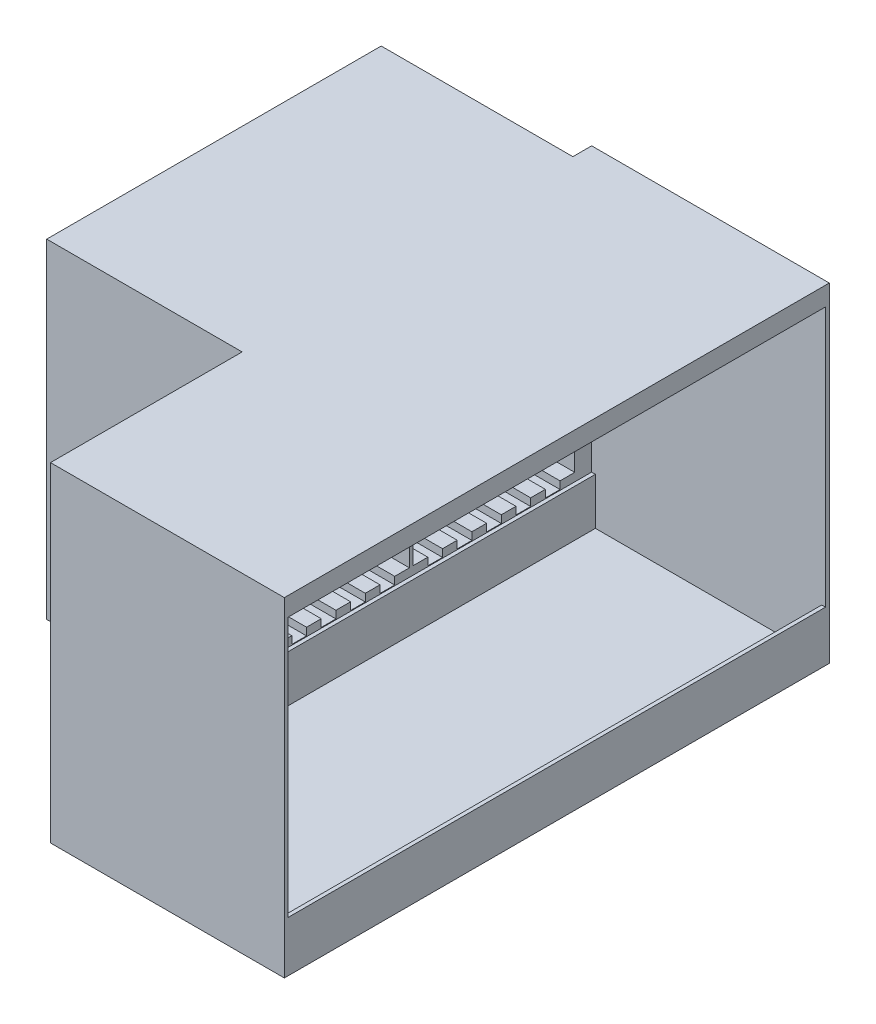
from build123d import *

# Parameters (mm, degrees)
SKETCH_3385_W                        = 940
SKETCH_3385_H                        = 876.56
EXTRUDE_3563_DEPTH                   = 1142.3
SKETCH_3604_W                        = 930
SKETCH_3604_H                        = 691.96
CUT_EXTRUDE_3663_DEPTH               = 622.3
SKETCH_3713_W                        = 430
SKETCH_3713_H                        = 320
CUT_EXTRUDE_3805_DEPTH               = 510
SKETCH_3856_W                        = 435
SKETCH_3856_H                        = 320
CUT_EXTRUDE_3949_DEPTH               = 10
SKETCH_3998_W                        = 602.3
SKETCH_3998_H                        = 930
CUT_EXTRUDE_4526_DEPTH               = 124.6
SKETCH_4575_W                        = 602.3
SKETCH_4575_H                        = 930
CUT_EXTRUDE_4706_DEPTH               = 40
SKETCH_4761_W                        = 39.090909091
SKETCH_4761_H                        = 20
CUT_EXTRUDE_4915_DEPTH               = 510
PATTERN_LINEAR_4969_COUNT            = 5
PATTERN_LINEAR_4969_PITCH            = 78.181818182
PATTERN_LINEAR_5037_COUNT            = 2
PATTERN_LINEAR_5037_PITCH            = 440
PATTERN_LINEAR_5037_COUNT_DIR2       = 2
PATTERN_LINEAR_5037_PITCH_DIR2       = 350
PATTERN_LINEAR_5037_COPY_1_SKETCH_W  = 39.090909091
PATTERN_LINEAR_5037_COPY_1_SKETCH_H  = 20
PATTERN_LINEAR_5037_COPY_1_DEPTH     = 510
PATTERN_LINEAR_5037_COPY_2_SKETCH_W  = 39.090909091
PATTERN_LINEAR_5037_COPY_2_SKETCH_H  = 20
PATTERN_LINEAR_5037_COPY_2_DEPTH     = 510
PATTERN_LINEAR_5037_COPY_3_SKETCH_W  = 39.090909091
PATTERN_LINEAR_5037_COPY_3_SKETCH_H  = 20
PATTERN_LINEAR_5037_COPY_3_DEPTH     = 510
PATTERN_LINEAR_5037_COPY_4_SKETCH_W  = 39.090909091
PATTERN_LINEAR_5037_COPY_4_SKETCH_H  = 20
PATTERN_LINEAR_5037_COPY_4_DEPTH     = 510
PATTERN_LINEAR_5037_COPY_5_SKETCH_W  = 39.090909091
PATTERN_LINEAR_5037_COPY_5_SKETCH_H  = 20
PATTERN_LINEAR_5037_COPY_5_DEPTH     = 510
PATTERN_LINEAR_5037_COPY_6_SKETCH_W  = 39.090909091
PATTERN_LINEAR_5037_COPY_6_SKETCH_H  = 20
PATTERN_LINEAR_5037_COPY_6_DEPTH     = 510
PATTERN_LINEAR_5037_COPY_7_SKETCH_W  = 39.090909091
PATTERN_LINEAR_5037_COPY_7_SKETCH_H  = 20
PATTERN_LINEAR_5037_COPY_7_DEPTH     = 510
PATTERN_LINEAR_5037_COPY_8_SKETCH_W  = 39.090909091
PATTERN_LINEAR_5037_COPY_8_SKETCH_H  = 20
PATTERN_LINEAR_5037_COPY_8_DEPTH     = 510
PATTERN_LINEAR_5037_COPY_9_SKETCH_W  = 39.090909091
PATTERN_LINEAR_5037_COPY_9_SKETCH_H  = 20
PATTERN_LINEAR_5037_COPY_9_DEPTH     = 510
PATTERN_LINEAR_5037_COPY_10_SKETCH_W = 39.090909091
PATTERN_LINEAR_5037_COPY_10_SKETCH_H = 20
PATTERN_LINEAR_5037_COPY_10_DEPTH    = 510
PATTERN_LINEAR_5037_COPY_11_SKETCH_W = 39.090909091
PATTERN_LINEAR_5037_COPY_11_SKETCH_H = 20
PATTERN_LINEAR_5037_COPY_11_DEPTH    = 510
PATTERN_LINEAR_5037_COPY_12_SKETCH_W = 39.090909091
PATTERN_LINEAR_5037_COPY_12_SKETCH_H = 20
PATTERN_LINEAR_5037_COPY_12_DEPTH    = 510
PATTERN_LINEAR_5037_COPY_13_SKETCH_W = 39.090909091
PATTERN_LINEAR_5037_COPY_13_SKETCH_H = 20
PATTERN_LINEAR_5037_COPY_13_DEPTH    = 510
PATTERN_LINEAR_5037_COPY_14_SKETCH_W = 39.090909091
PATTERN_LINEAR_5037_COPY_14_SKETCH_H = 20
PATTERN_LINEAR_5037_COPY_14_DEPTH    = 510
PATTERN_LINEAR_5037_COPY_15_SKETCH_W = 39.090909091
PATTERN_LINEAR_5037_COPY_15_SKETCH_H = 20
PATTERN_LINEAR_5037_COPY_15_DEPTH    = 510
EXTRUDE_5697_DEPTH                   = 500
SKETCH_5778_W                        = 622.3
SKETCH_5778_H                        = 876.56
EXTRUDE_5937_DEPTH                   = 10
SKETCH_14_W                          = 510
SKETCH_14_H                          = 876.56
CUT_EXTRUDE_1_DEPTH                  = 50


with BuildPart() as part:
    # Sketch 3385 → Extrude 3563 (new body)
    with BuildSketch(Plane(origin=(0, 0, 0), x_dir=(0, 0, -1), z_dir=(1, 0, 0))):
        Rectangle(SKETCH_3385_W, SKETCH_3385_H)
    extrude(amount=EXTRUDE_3563_DEPTH)

    # Sketch 3604 → Cut-Extrude 3663 (cut)
    with BuildSketch(Plane(origin=(1142.3, 0, 0), x_dir=(0, 0, -1), z_dir=(1, 0, 0))):
        with Locations((-5, 42.3)):
            Rectangle(SKETCH_3604_W, SKETCH_3604_H)
    extrude(amount=-CUT_EXTRUDE_3663_DEPTH, mode=Mode.SUBTRACT)

    # Sketch 3713 → Cut-Extrude 3805 (cut)
    with BuildSketch(Plane(origin=(520, 0, 0), x_dir=(0, 0, -1), z_dir=(1, 0, 0))):
        with Locations((-240, 228.28)):
            Rectangle(SKETCH_3713_W, SKETCH_3713_H)
    cut_extrude_3805 = extrude(amount=-CUT_EXTRUDE_3805_DEPTH, mode=Mode.SUBTRACT)

    # Sketch 3856 → Cut-Extrude 3949 (cut)
    with BuildSketch(Plane.ZY):
        with Locations((242.5, 228.28)):
            Rectangle(SKETCH_3856_W, SKETCH_3856_H)
    cut_extrude_3949 = extrude(amount=-CUT_EXTRUDE_3949_DEPTH, mode=Mode.SUBTRACT)

    # Sketch 3998 → Cut-Extrude 4526 (cut)
    with BuildSketch(Plane(origin=(0, -303.68, 0), x_dir=(1, 0, 0), z_dir=(0, 1, 0))):
        with Locations((831.15, -5)):
            Rectangle(SKETCH_3998_W, SKETCH_3998_H)
    extrude(amount=-CUT_EXTRUDE_4526_DEPTH, mode=Mode.SUBTRACT)

    # Sketch 4575 → Cut-Extrude 4706 (cut)
    with BuildSketch(Plane.XZ.offset(-388.28)):
        with Locations((831.15, 5)):
            Rectangle(SKETCH_4575_W, SKETCH_4575_H)
    extrude(amount=-CUT_EXTRUDE_4706_DEPTH, mode=Mode.SUBTRACT)

    # Sketch 4761 → Cut-Extrude 4915 (cut)
    with BuildSketch(Plane(origin=(520, 0, 0), x_dir=(0, 0, -1), z_dir=(1, 0, 0))):
        with Locations((-396.363636364, 58.28)):
            Rectangle(SKETCH_4761_W, SKETCH_4761_H)
    cut_extrude_4915 = extrude(amount=-CUT_EXTRUDE_4915_DEPTH, mode=Mode.SUBTRACT)

    # Pattern Linear 4969: Cut-Extrude 4915 ×5
    with Locations(*[(0, 0, -i * PATTERN_LINEAR_4969_PITCH) for i in range(1, PATTERN_LINEAR_4969_COUNT)]):
        add(cut_extrude_4915, mode=Mode.SUBTRACT)

    # Pattern Linear 5037: Cut-Extrude 3805, Cut-Extrude 3949 2 × 2
    with Locations(*[(0, -j * PATTERN_LINEAR_5037_PITCH_DIR2, -i * PATTERN_LINEAR_5037_PITCH) for i in range(PATTERN_LINEAR_5037_COUNT) for j in range(PATTERN_LINEAR_5037_COUNT_DIR2) if (i, j) != (0, 0)]):
        add(cut_extrude_3805, mode=Mode.SUBTRACT)
        add(cut_extrude_3949, mode=Mode.SUBTRACT)

    # Pattern Linear 5037 copy 1 sketch → Pattern Linear 5037 copy 1 (cut)
    with BuildSketch(Plane(origin=(520, -350, -78.181818182), x_dir=(0, 0, -1), z_dir=(1, 0, 0))):
        with Locations((-396.363636364, 58.28)):
            Rectangle(PATTERN_LINEAR_5037_COPY_1_SKETCH_W, PATTERN_LINEAR_5037_COPY_1_SKETCH_H)
    extrude(amount=-PATTERN_LINEAR_5037_COPY_1_DEPTH, mode=Mode.SUBTRACT)

    # Pattern Linear 5037 copy 2 sketch → Pattern Linear 5037 copy 2 (cut)
    with BuildSketch(Plane(origin=(520, 0, -518.181818182), x_dir=(0, 0, -1), z_dir=(1, 0, 0))):
        with Locations((-396.363636364, 58.28)):
            Rectangle(PATTERN_LINEAR_5037_COPY_2_SKETCH_W, PATTERN_LINEAR_5037_COPY_2_SKETCH_H)
    extrude(amount=-PATTERN_LINEAR_5037_COPY_2_DEPTH, mode=Mode.SUBTRACT)

    # Pattern Linear 5037 copy 3 sketch → Pattern Linear 5037 copy 3 (cut)
    with BuildSketch(Plane(origin=(520, -350, -518.181818182), x_dir=(0, 0, -1), z_dir=(1, 0, 0))):
        with Locations((-396.363636364, 58.28)):
            Rectangle(PATTERN_LINEAR_5037_COPY_3_SKETCH_W, PATTERN_LINEAR_5037_COPY_3_SKETCH_H)
    extrude(amount=-PATTERN_LINEAR_5037_COPY_3_DEPTH, mode=Mode.SUBTRACT)

    # Pattern Linear 5037 copy 4 sketch → Pattern Linear 5037 copy 4 (cut)
    with BuildSketch(Plane(origin=(520, -350, -156.363636364), x_dir=(0, 0, -1), z_dir=(1, 0, 0))):
        with Locations((-396.363636364, 58.28)):
            Rectangle(PATTERN_LINEAR_5037_COPY_4_SKETCH_W, PATTERN_LINEAR_5037_COPY_4_SKETCH_H)
    extrude(amount=-PATTERN_LINEAR_5037_COPY_4_DEPTH, mode=Mode.SUBTRACT)

    # Pattern Linear 5037 copy 5 sketch → Pattern Linear 5037 copy 5 (cut)
    with BuildSketch(Plane(origin=(520, 0, -596.363636364), x_dir=(0, 0, -1), z_dir=(1, 0, 0))):
        with Locations((-396.363636364, 58.28)):
            Rectangle(PATTERN_LINEAR_5037_COPY_5_SKETCH_W, PATTERN_LINEAR_5037_COPY_5_SKETCH_H)
    extrude(amount=-PATTERN_LINEAR_5037_COPY_5_DEPTH, mode=Mode.SUBTRACT)

    # Pattern Linear 5037 copy 6 sketch → Pattern Linear 5037 copy 6 (cut)
    with BuildSketch(Plane(origin=(520, -350, -596.363636364), x_dir=(0, 0, -1), z_dir=(1, 0, 0))):
        with Locations((-396.363636364, 58.28)):
            Rectangle(PATTERN_LINEAR_5037_COPY_6_SKETCH_W, PATTERN_LINEAR_5037_COPY_6_SKETCH_H)
    extrude(amount=-PATTERN_LINEAR_5037_COPY_6_DEPTH, mode=Mode.SUBTRACT)

    # Pattern Linear 5037 copy 7 sketch → Pattern Linear 5037 copy 7 (cut)
    with BuildSketch(Plane(origin=(520, -350, -234.545454545), x_dir=(0, 0, -1), z_dir=(1, 0, 0))):
        with Locations((-396.363636364, 58.28)):
            Rectangle(PATTERN_LINEAR_5037_COPY_7_SKETCH_W, PATTERN_LINEAR_5037_COPY_7_SKETCH_H)
    extrude(amount=-PATTERN_LINEAR_5037_COPY_7_DEPTH, mode=Mode.SUBTRACT)

    # Pattern Linear 5037 copy 8 sketch → Pattern Linear 5037 copy 8 (cut)
    with BuildSketch(Plane(origin=(520, 0, -674.545454545), x_dir=(0, 0, -1), z_dir=(1, 0, 0))):
        with Locations((-396.363636364, 58.28)):
            Rectangle(PATTERN_LINEAR_5037_COPY_8_SKETCH_W, PATTERN_LINEAR_5037_COPY_8_SKETCH_H)
    extrude(amount=-PATTERN_LINEAR_5037_COPY_8_DEPTH, mode=Mode.SUBTRACT)

    # Pattern Linear 5037 copy 9 sketch → Pattern Linear 5037 copy 9 (cut)
    with BuildSketch(Plane(origin=(520, -350, -674.545454545), x_dir=(0, 0, -1), z_dir=(1, 0, 0))):
        with Locations((-396.363636364, 58.28)):
            Rectangle(PATTERN_LINEAR_5037_COPY_9_SKETCH_W, PATTERN_LINEAR_5037_COPY_9_SKETCH_H)
    extrude(amount=-PATTERN_LINEAR_5037_COPY_9_DEPTH, mode=Mode.SUBTRACT)

    # Pattern Linear 5037 copy 10 sketch → Pattern Linear 5037 copy 10 (cut)
    with BuildSketch(Plane(origin=(520, -350, -312.727272727), x_dir=(0, 0, -1), z_dir=(1, 0, 0))):
        with Locations((-396.363636364, 58.28)):
            Rectangle(PATTERN_LINEAR_5037_COPY_10_SKETCH_W, PATTERN_LINEAR_5037_COPY_10_SKETCH_H)
    extrude(amount=-PATTERN_LINEAR_5037_COPY_10_DEPTH, mode=Mode.SUBTRACT)

    # Pattern Linear 5037 copy 11 sketch → Pattern Linear 5037 copy 11 (cut)
    with BuildSketch(Plane(origin=(520, 0, -752.727272727), x_dir=(0, 0, -1), z_dir=(1, 0, 0))):
        with Locations((-396.363636364, 58.28)):
            Rectangle(PATTERN_LINEAR_5037_COPY_11_SKETCH_W, PATTERN_LINEAR_5037_COPY_11_SKETCH_H)
    extrude(amount=-PATTERN_LINEAR_5037_COPY_11_DEPTH, mode=Mode.SUBTRACT)

    # Pattern Linear 5037 copy 12 sketch → Pattern Linear 5037 copy 12 (cut)
    with BuildSketch(Plane(origin=(520, -350, -752.727272727), x_dir=(0, 0, -1), z_dir=(1, 0, 0))):
        with Locations((-396.363636364, 58.28)):
            Rectangle(PATTERN_LINEAR_5037_COPY_12_SKETCH_W, PATTERN_LINEAR_5037_COPY_12_SKETCH_H)
    extrude(amount=-PATTERN_LINEAR_5037_COPY_12_DEPTH, mode=Mode.SUBTRACT)

    # Pattern Linear 5037 copy 13 sketch → Pattern Linear 5037 copy 13 (cut)
    with BuildSketch(Plane(origin=(520, -350, 0), x_dir=(0, 0, -1), z_dir=(1, 0, 0))):
        with Locations((-396.363636364, 58.28)):
            Rectangle(PATTERN_LINEAR_5037_COPY_13_SKETCH_W, PATTERN_LINEAR_5037_COPY_13_SKETCH_H)
    extrude(amount=-PATTERN_LINEAR_5037_COPY_13_DEPTH, mode=Mode.SUBTRACT)

    # Pattern Linear 5037 copy 14 sketch → Pattern Linear 5037 copy 14 (cut)
    with BuildSketch(Plane(origin=(520, 0, -440), x_dir=(0, 0, -1), z_dir=(1, 0, 0))):
        with Locations((-396.363636364, 58.28)):
            Rectangle(PATTERN_LINEAR_5037_COPY_14_SKETCH_W, PATTERN_LINEAR_5037_COPY_14_SKETCH_H)
    extrude(amount=-PATTERN_LINEAR_5037_COPY_14_DEPTH, mode=Mode.SUBTRACT)

    # Pattern Linear 5037 copy 15 sketch → Pattern Linear 5037 copy 15 (cut)
    with BuildSketch(Plane(origin=(520, -350, -440), x_dir=(0, 0, -1), z_dir=(1, 0, 0))):
        with Locations((-396.363636364, 58.28)):
            Rectangle(PATTERN_LINEAR_5037_COPY_15_SKETCH_W, PATTERN_LINEAR_5037_COPY_15_SKETCH_H)
    extrude(amount=-PATTERN_LINEAR_5037_COPY_15_DEPTH, mode=Mode.SUBTRACT)

    # Sketch 5109 → Extrude 5697 (add)
    with BuildSketch(Plane.XY.offset(470)):
        Polygon((1142.3, -438.28), (1142.3, -303.68), (1132.3, -303.68), (1132.3, -428.28), (530, -428.28), (530, -303.68), (520, -303.68), (520, -438.28), align=None)
        Polygon((1132.3, 388.28), (1142.3, 388.28), (1142.3, 438.28), (520, 438.28), (520, 388.28), (530, 388.28), (530, 428.28), (1132.3, 428.28), align=None)
    extrude(amount=EXTRUDE_5697_DEPTH)

    # Sketch 5778 → Extrude 5937 (add)
    with BuildSketch(Plane.XY.offset(970)):
        with Locations((831.15, 0)):
            Rectangle(SKETCH_5778_W, SKETCH_5778_H)
    extrude(amount=EXTRUDE_5937_DEPTH)

    # Эскиз14 → Вырез-Вытянуть1 (cut)
    with BuildSketch(Plane(origin=(0, 0, -470), x_dir=(-1, 0, 0), z_dir=(0, 0, -1))):
        with Locations((-255, 0)):
            Rectangle(SKETCH_14_W, SKETCH_14_H)
    extrude(amount=-CUT_EXTRUDE_1_DEPTH, mode=Mode.SUBTRACT)


solid = part.part
